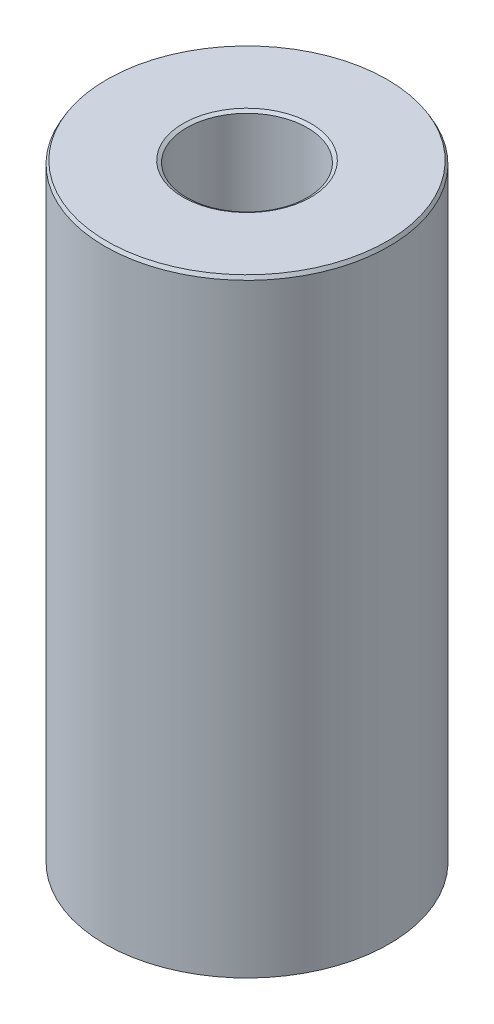
from build123d import *
from OCP.BRepFilletAPI import BRepFilletAPI_MakeChamfer

# Parameters (mm, degrees)
SKETCH1_R           = 32.5
BOSS_EXTRUDE1_DEPTH = 139.398280249
SKETCH2_R           = 13.826600983
CUT_EXTRUDE1_DEPTH  = 147.780041342
CHAMFER1_SIZE       = 0.787750434
CHAMFER1_SIZE2      = 0.454807925


with BuildPart() as part:
    # Sketch1 → Boss-Extrude1 (new body)
    with BuildSketch(Plane(origin=(0, 0, 0), x_dir=(1, 0, 0), z_dir=(0, 1, 0))):
        Circle(SKETCH1_R)
    extrude(amount=BOSS_EXTRUDE1_DEPTH)

    # Sketch2 → Cut-Extrude1 (cut, through all)
    with BuildSketch(Plane(origin=(0, 0, 0), x_dir=(1, 0, 0), z_dir=(0, 1, 0))):
        Circle(SKETCH2_R)
    extrude(amount=CUT_EXTRUDE1_DEPTH, mode=Mode.SUBTRACT)

    # Chamfer1: one chamfer whose edges measure the first distance from different faces: ONE call of the kernel's chamfer builder (chamfer() names one face for all edges)
    chamfer1_edges_1 = [part.edges().sort_by_distance(p)[0] for p in [
        (-13.826600983, 139.398280249, 0),
    ]]
    chamfer1_side_1 = [part.faces().sort_by_distance(p)[0] for p in [
        (-31.580761184, 139.398280249, 0),
    ]]
    chamfer1_edges_2 = [part.edges().sort_by_distance(p)[0] for p in [
        (-13.826600983, 0, 0),
    ]]
    chamfer1_side_2 = [part.faces().sort_by_distance(p)[0] for p in [
        (-13.826600983, 69.699140125, 0),
    ]]
    chamfer1_edges_3 = [part.edges().sort_by_distance(p)[0] for p in [
        (-32.5, 0, 0),
    ]]
    chamfer1_side_3 = [part.faces().sort_by_distance(p)[0] for p in [
        (-31.580761184, 0, 0),
    ]]
    chamfer1_edges_4 = [part.edges().sort_by_distance(p)[0] for p in [
        (-32.5, 139.398280249, 0),
    ]]
    chamfer1_side_4 = [part.faces().sort_by_distance(p)[0] for p in [
        (-32.5, 69.699140125, 0),
    ]]
    chamfer1 = BRepFilletAPI_MakeChamfer(part.part.solid().wrapped)
    for e in chamfer1_edges_1:
        chamfer1.Add(CHAMFER1_SIZE, CHAMFER1_SIZE2, e.wrapped, chamfer1_side_1[0].wrapped)  # the first distance lies on this face
    for e in chamfer1_edges_2:
        chamfer1.Add(CHAMFER1_SIZE, CHAMFER1_SIZE2, e.wrapped, chamfer1_side_2[0].wrapped)  # the first distance lies on this face
    for e in chamfer1_edges_3:
        chamfer1.Add(CHAMFER1_SIZE, CHAMFER1_SIZE2, e.wrapped, chamfer1_side_3[0].wrapped)  # the first distance lies on this face
    for e in chamfer1_edges_4:
        chamfer1.Add(CHAMFER1_SIZE, CHAMFER1_SIZE2, e.wrapped, chamfer1_side_4[0].wrapped)  # the first distance lies on this face
    add(Compound.cast(chamfer1.Shape()), mode=Mode.REPLACE)


solid = part.part
